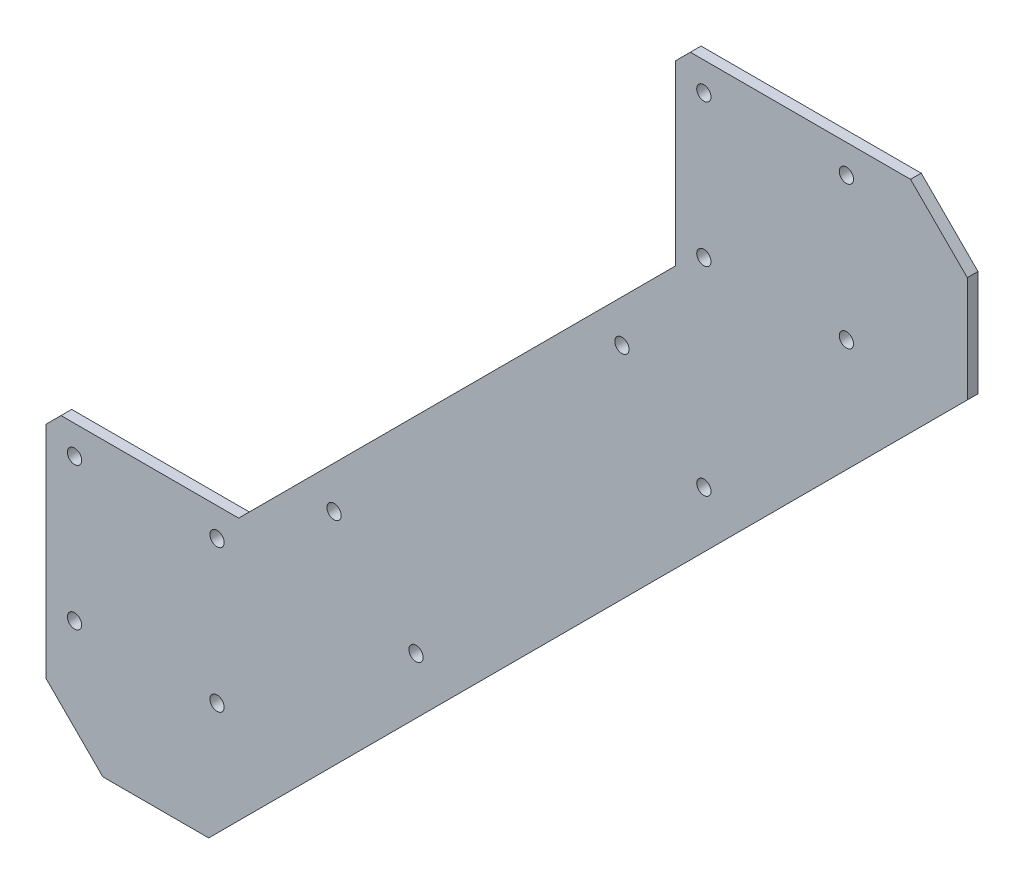
from build123d import *

# Parameters (mm, degrees)
SKETCH1_R           = 2
BOSS_EXTRUDE1_DEPTH = 3


with BuildPart() as part:
    # Sketch1 → Boss-Extrude1 (new body)
    with BuildSketch(Plane.XY):
        Polygon((-26.611033891, -145.8), (-30.821945784, -150.010911893), (-30.821945784, -211.799971874), (-14.886075416, -227.735842242), (14.845903689, -227.735842242), (227.735842242, -14.845903689), (227.735842242, 14.886075416), (211.799971874, 30.821945784), (150.010911893, 30.821945784), (145.8, 26.611033891), (145.8, -23.244054901), (23.244054901, -145.8), align=None)
        with Locations((-22.821945784, -193.8)):
            Circle(SKETCH1_R, mode=Mode.SUBTRACT)
        with Locations((17.178054216, -193.8)):
            Circle(SKETCH1_R, mode=Mode.SUBTRACT)
        with Locations((-22.821945784, -153.8)):
            Circle(SKETCH1_R, mode=Mode.SUBTRACT)
        with Locations((17.178054216, -153.8)):
            Circle(SKETCH1_R, mode=Mode.SUBTRACT)
        with Locations((50.024156778, -130.811703578)):
            Circle(SKETCH1_R, mode=Mode.SUBTRACT)
        with Locations((73.0124532, -153.8)):
            Circle(SKETCH1_R, mode=Mode.SUBTRACT)
        with Locations((153.8, -73.0124532)):
            Circle(SKETCH1_R, mode=Mode.SUBTRACT)
        with Locations((130.811703578, -50.024156778)):
            Circle(SKETCH1_R, mode=Mode.SUBTRACT)
        with Locations((153.8, -17.178054216)):
            Circle(SKETCH1_R, mode=Mode.SUBTRACT)
        with Locations((153.8, 22.821945784)):
            Circle(SKETCH1_R, mode=Mode.SUBTRACT)
        with Locations((193.8, -17.178054216)):
            Circle(SKETCH1_R, mode=Mode.SUBTRACT)
        with Locations((193.8, 22.821945784)):
            Circle(SKETCH1_R, mode=Mode.SUBTRACT)
    extrude(amount=BOSS_EXTRUDE1_DEPTH)


solid = part.part
